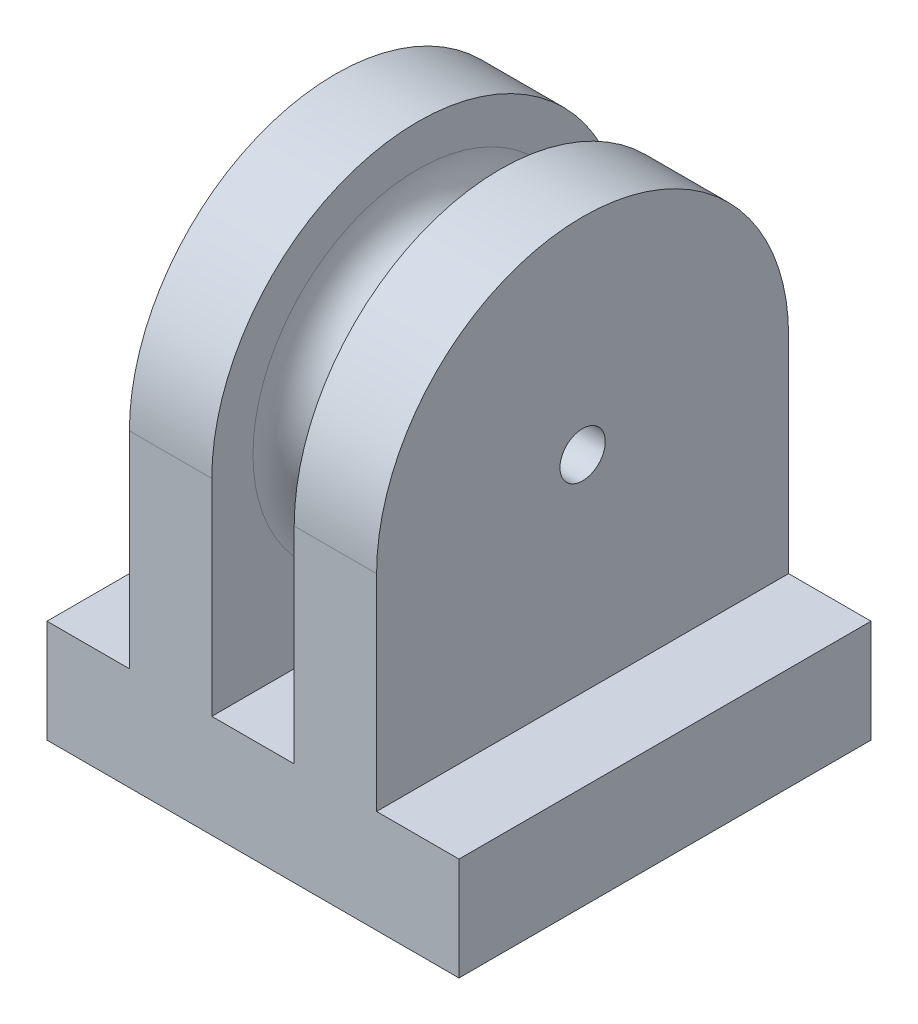
from build123d import *

# Parameters (mm, degrees)
SKETCH1_W           = 20
SKETCH1_H           = 20
BOSS_EXTRUDE1_DEPTH = 5
SKETCH3_W           = 4
SKETCH3_H           = 20
BOSS_EXTRUDE2_DEPTH = 10
SKETCH4_R           = 10
BOSS_EXTRUDE3_DEPTH = 4
BOSS_EXTRUDE4_START = -4
SKETCH5_R           = 10
BOSS_EXTRUDE4_DEPTH = 4
SKETCH6_R           = 1.1
CUT_EXTRUDE1_DEPTH  = 36.791060336
SKETCH7_R           = 0.5
CUT_EXTRUDE2_DEPTH  = 35.641016151
SKETCH9_R           = 6
BOSS_EXTRUDE5_DEPTH = 4
SKETCH10_R          = 1.1
CUT_EXTRUDE3_DEPTH  = 4
FILLET1_R           = 2


with BuildPart() as part:
    # Sketch1 → Boss-Extrude1 (new body)
    with BuildSketch(Plane(origin=(0, 0, 0), x_dir=(1, 0, 0), z_dir=(0, 1, 0))):
        with Locations((10, 10)):
            Rectangle(SKETCH1_W, SKETCH1_H)
    extrude(amount=BOSS_EXTRUDE1_DEPTH)

    # Sketch3 → Boss-Extrude2 (add)
    with BuildSketch(Plane(origin=(0, 5, 0), x_dir=(1, 0, 0), z_dir=(0, 1, 0))):
        with Locations((6, 10)):
            Rectangle(SKETCH3_W, SKETCH3_H)
        with Locations((14, 10)):
            Rectangle(SKETCH3_W, SKETCH3_H)
    extrude(amount=BOSS_EXTRUDE2_DEPTH)

    # Sketch4 → Boss-Extrude3 (add)
    with BuildSketch(Plane.ZY.offset(-4)):
        with Locations((-10, 15)):
            Circle(SKETCH4_R)
    extrude(amount=-BOSS_EXTRUDE3_DEPTH)

    # Sketch5 → Boss-Extrude4 (add)
    with BuildSketch(Plane(origin=(16, 0, 0), x_dir=(0, 0, -1), z_dir=(1, 0, 0)).offset(BOSS_EXTRUDE4_START)):
        with Locations((10, 15)):
            Circle(SKETCH5_R)
    extrude(amount=BOSS_EXTRUDE4_DEPTH)

    # Sketch6 → Cut-Extrude1 (cut, through all)
    with BuildSketch(Plane.ZY.offset(-4)):
        with Locations((-10, 15)):
            Circle(SKETCH6_R)
    extrude(amount=-CUT_EXTRUDE1_DEPTH, mode=Mode.SUBTRACT)

    # Sketch7 → Cut-Extrude2 (cut, through all)
    with BuildSketch(Plane(origin=(0, 5, 0), x_dir=(1, 0, 0), z_dir=(0, 1, 0))):
        with Locations(Location((10, 4, 0), (0, 0, 270))):
            Circle(SKETCH7_R)
        with Locations(Location((10, 16, 0), (0, 0, 90))):
            Circle(SKETCH7_R)
    extrude(amount=-CUT_EXTRUDE2_DEPTH, mode=Mode.SUBTRACT)

    # Sketch9 → Boss-Extrude5 (add)
    with BuildSketch(Plane(origin=(8, 0, 0), x_dir=(0, 0, -1), z_dir=(1, 0, 0))):
        with Locations(Location((10, 15, 0), (0, 0, 180))):
            Circle(SKETCH9_R)
    extrude(amount=BOSS_EXTRUDE5_DEPTH)

    # Sketch10 → Cut-Extrude3 (cut)
    with BuildSketch(Plane(origin=(8, 0, 0), x_dir=(0, 0, -1), z_dir=(1, 0, 0))):
        with Locations(Location((10, 15, 0), (0, 0, 180))):
            Circle(SKETCH10_R)
    extrude(amount=CUT_EXTRUDE3_DEPTH, mode=Mode.SUBTRACT)

    # Fillet1
    fillet1_edges = [part.edges().sort_by_distance(p)[0] for p in [
        (12, 15, -16),
        (8, 15, -16),
    ]]
    fillet(fillet1_edges, radius=FILLET1_R - 0.0001)  # a hair under: the kernel refuses the full size


solid = part.part
